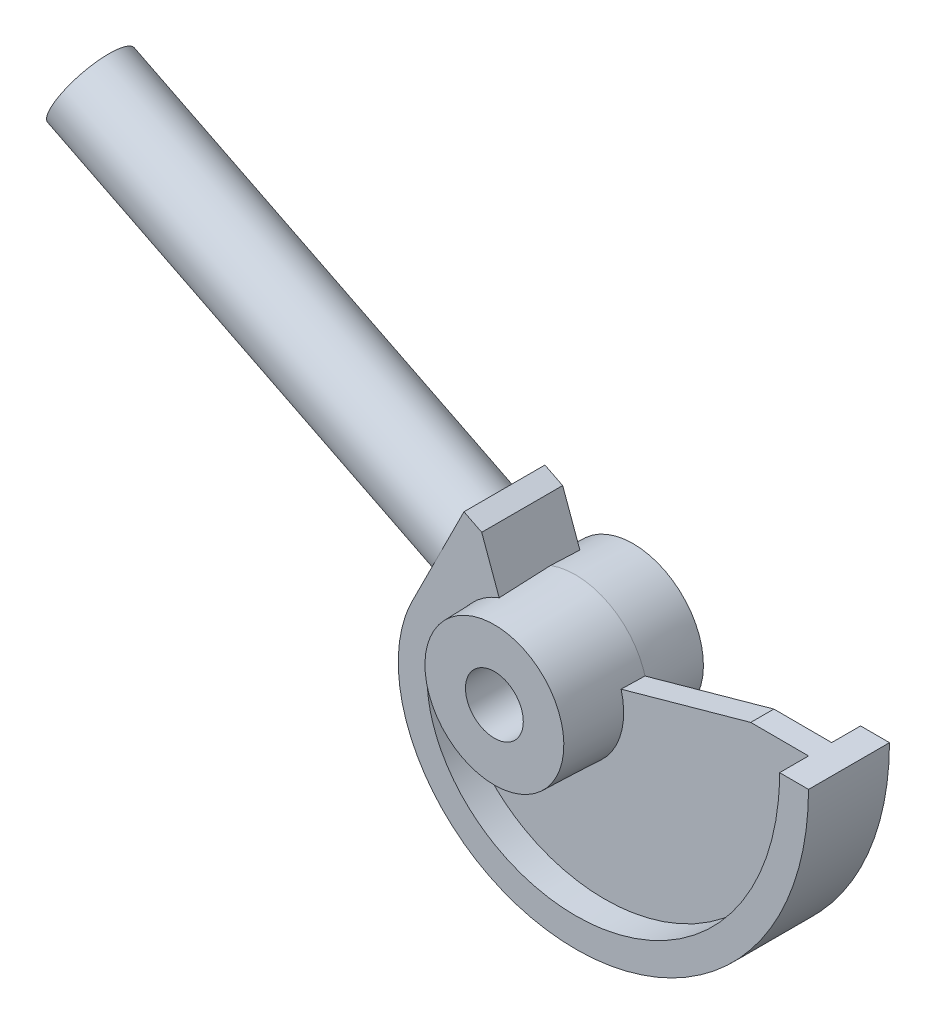
from build123d import *

# Parameters (mm, degrees)
SKETCH_1_R           = 10.000000001
EXTRUDE_1_DEPTH      = 8
EXTRUDE_2_DEPTH      = 10
EXTRUDE_2_DEPTH_BACK = 18
EXTRUDE_4_DEPTH      = 20
EXTRUDE_4_TAPER      = 2
SKETCH_5_R           = 10
CUT_EXTRUDE_1_DEPTH  = 48
EXTRUDE_START        = -14
EXTRUDE_5_DEPTH      = 28
SKETCH_7_R           = 14
EXTRUDE_6_DEPTH      = 150
MOVE_BODY_1_ANGLE    = 160


# Read off the part's stored shape, not the designer's step: 凸台-拉伸3, 凸台-拉伸5
with BuildPart() as part:
    # 草图1 → 凸台-拉伸1 (new body)
    with BuildSketch(Plane.XY):
        Circle(SKETCH_1_R)
        with BuildLine():
            Line((-99.223415369, 15.875832346), (-71.057498037, 5.54717799))
            Line((-71.057498037, 5.54717799), (0, 0))
            Line((0, 0), (0, -25.00478934))
            Line((0, -25.00478934), (23.416407848, -26.832815739))
            add(Edge.make_bspline(
                [(23.416407848, -26.832815739), (23.559255777, -26.761391774), (23.857489252, -26.609782504), (24.343322546, -26.356143142), (25.001847908, -26.00202666), (25.895002872, -25.493833349), (26.689827796, -25.015527515), (27.443014709, -24.541367746), (28.44946677, -23.878396743), (30.180130615, -22.657518607), (32.463639395, -20.822910489), (35.803918719, -17.675778925), (39.356057937, -13.452382092), (43.810657679, -6.319948363), (47.26514501, 2.912424346), (48.687565133, 13.74600062), (47.956016905, 23.948129205), (45.527543401, 33.31383343), (41.766058602, 41.743075171), (35.35780408, 51.679214297), (25.341292826, 61.631560208), (11.525255636, 69.785622537), (-3.116720541, 74.453616351), (-17.875896804, 75.980775652), (-32.230785273, 74.726921151), (-50.32340393, 69.819482921), (-70.232141124, 58.486051284), (-85.364335796, 42.337960666), (-93.213462614, 29.471917912), (-96.911556554, 21.787367795), (-98.494293842, 17.864123943), (-99.223415369, 15.875832346)],
                knots=[0.039541182, 0.039541182, 0.039541182, 0.039541182, 0.040360106, 0.04117903, 0.042816878, 0.044454725, 0.046092573, 0.047730421, 0.049368269, 0.052643964, 0.059195355, 0.065746746, 0.078849528, 0.091952311, 0.118157875, 0.144363439, 0.170569003, 0.196774568, 0.222980132, 0.249185696, 0.301596825, 0.354007953, 0.406419082, 0.45883021, 0.511241339, 0.563652467, 0.668474724, 0.773296981, 0.82570811, 0.851913674, 0.878119238, 0.878119238, 0.878119238, 0.878119238], degree=3))
        make_face()
    extrude(amount=EXTRUDE_1_DEPTH)

    # 草图2 → 凸台-拉伸2 (add, two sides: drawn at the far end of the back side and taken through both)
    with BuildSketch(Plane(origin=(0, 0, 0), x_dir=(-1, 0, 0), z_dir=(0, 0, -1)).offset(-EXTRUDE_2_DEPTH_BACK)):
        with BuildLine():
            Line((-23.416407848, -26.832815739), (-18.944271899, -17.888543826))
            add(Edge.make_bspline(
                [(-18.944271899, -17.888543826), (-19.052705032, -17.834327259), (-19.279014375, -17.71924736), (-19.648152988, -17.526510294), (-20.157464576, -17.252862811), (-20.848872628, -16.859261983), (-21.642713236, -16.38143627), (-22.609327917, -15.759508594), (-24.135094314, -14.683161103), (-25.88889207, -13.274264185), (-28.481097704, -10.832666814), (-31.239689124, -7.553621002), (-34.737099736, -1.958117593), (-37.47574582, 5.346529302), (-38.623443824, 14.038278874), (-38.034234701, 22.314418593), (-35.383511893, 32.549710241), (-29.284340235, 43.56584113), (-19.178025873, 53.624814399), (-7.415995151, 60.576443845), (5.163786787, 64.593266285), (22.211265662, 66.362987302), (42.815452692, 62.532491918), (63.927151805, 50.528041572), (77.41272726, 36.156200275), (85.445738505, 22.987041434), (88.522694561, 16.010953304), (89.834776258, 12.432947561)],
                knots=[0.039541182, 0.039541182, 0.039541182, 0.039541182, 0.040360106, 0.04117903, 0.042816878, 0.044454725, 0.046092573, 0.049368269, 0.052643964, 0.059195355, 0.065746746, 0.078849528, 0.091952311, 0.118157875, 0.144363439, 0.170569003, 0.196774568, 0.249185696, 0.301596825, 0.354007953, 0.406419082, 0.45883021, 0.563652467, 0.668474724, 0.773296981, 0.82570811, 0.878119238, 0.878119238, 0.878119238, 0.878119238], degree=3))
            Line((89.834776258, 12.432947561), (99.223415369, 15.875832346))
            add(Edge.make_bspline(
                [(-23.416407848, -26.832815739), (-23.559255777, -26.761391774), (-23.857489252, -26.609782504), (-24.343322546, -26.356143142), (-25.001847908, -26.00202666), (-25.895002872, -25.493833349), (-26.689827796, -25.015527515), (-27.443014709, -24.541367746), (-28.44946677, -23.878396743), (-30.180130615, -22.657518607), (-32.463639395, -20.822910489), (-35.803918719, -17.675778925), (-39.356057937, -13.452382092), (-43.810657679, -6.319948363), (-47.26514501, 2.912424346), (-48.687565133, 13.74600062), (-47.956016905, 23.948129205), (-45.527543401, 33.31383343), (-41.766058602, 41.743075171), (-35.35780408, 51.679214297), (-25.341292826, 61.631560208), (-11.525255636, 69.785622537), (3.116720541, 74.453616351), (17.875896804, 75.980775652), (32.230785273, 74.726921151), (50.32340393, 69.819482921), (70.232141124, 58.486051284), (85.364335796, 42.337960666), (93.213462614, 29.471917912), (96.911556554, 21.787367795), (98.494293842, 17.864123943), (99.223415369, 15.875832346)],
                knots=[0.039541182, 0.039541182, 0.039541182, 0.039541182, 0.040360106, 0.04117903, 0.042816878, 0.044454725, 0.046092573, 0.047730421, 0.049368269, 0.052643964, 0.059195355, 0.065746746, 0.078849528, 0.091952311, 0.118157875, 0.144363439, 0.170569003, 0.196774568, 0.222980132, 0.249185696, 0.301596825, 0.354007953, 0.406419082, 0.45883021, 0.511241339, 0.563652467, 0.668474724, 0.773296981, 0.82570811, 0.851913674, 0.878119238, 0.878119238, 0.878119238, 0.878119238], degree=3))
        make_face()
    extrude(amount=EXTRUDE_2_DEPTH + EXTRUDE_2_DEPTH_BACK)

    # 凸台-拉伸3 outline → 凸台-拉伸3 (revolve)
    with BuildSketch(Plane.XZ):
        Polygon((10.000000001, 8), (10.000000001, 0), (0, 0), (0, -20), (24.306373953, -20), (25.004789342, 0), (24.725423186, 8), align=None)
    revolve(axis=Axis((0, 0, 0), (0, 0, 1)))

    # 草图4 → 凸台-拉伸4 (add)
    with BuildSketch(Plane.XY.offset(8)):
        with BuildLine():
            ThreePointArc((24.725423186, 0), (0.962911043, 24.706666187), (-24.650423647, 1.924361134))
            ThreePointArc((-24.650423647, 1.924361134), (-18.151132129, -16.789370273), (0, -24.725423186))
            ThreePointArc((0, -24.725423186), (17.483514403, -17.483514403), (24.725423186, 0))
        make_face()
    extrude(amount=EXTRUDE_4_DEPTH, taper=EXTRUDE_4_TAPER)

    # 草图5 → 切除-拉伸1 (cut)
    with BuildSketch(Plane(origin=(0, 0, -20), x_dir=(-1, 0, 0), z_dir=(0, 0, -1))):
        Circle(SKETCH_5_R)
    extrude(amount=-CUT_EXTRUDE_1_DEPTH, mode=Mode.SUBTRACT)

    # 凸台-拉伸5 outline → 凸台-拉伸5 (add)
    with BuildSketch(Plane.XY.offset(4).offset(EXTRUDE_START)):
        with BuildLine():
            Line((0, -42.050906086), (4.717060846, -47.040869425))
            Line((4.717060846, -47.040869425), (33.785028526, -19.562637042))
            Line((33.785028526, -19.562637042), (22.709671659, -7.846522593))
            ThreePointArc((22.709671659, -7.846522593), (13.94217781, -19.568157337), (0, -24.027007797))
            Line((0, -24.027007797), (0, -42.050906086))
        make_face()
    extrude(amount=EXTRUDE_5_DEPTH)

    # 草图7 → 凸台-拉伸6 (add)
    with BuildSketch(Plane(origin=(25.70930342, -27.19669848, 0), x_dir=(0, 0, -1), z_dir=(0.6869558095891056, -0.7266991920126075, 0))):
        with Locations((-4, -8.887114234)):
            Circle(SKETCH_7_R)
    extrude(amount=EXTRUDE_6_DEPTH)


with BuildPart() as part_1:
    # Move Body 1: moved
    add(part.part.rotate(Axis((0, 0, 0), (0, 0, -1)), MOVE_BODY_1_ANGLE))


solid = part_1.part
